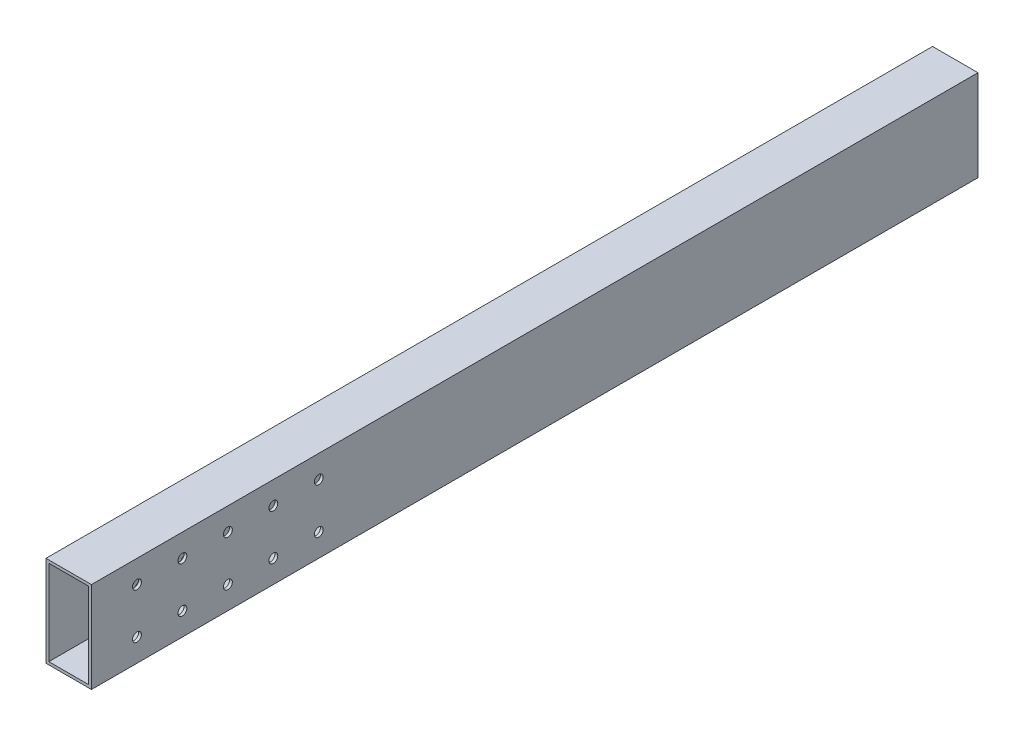
from build123d import *

# Parameters (mm, degrees)
SKETCH1_W           = 25.4
SKETCH1_H           = 50.8
SKETCH1_W_2         = 22.225
SKETCH1_H_2         = 47.625
BOSS_EXTRUDE1_DEPTH = 495.3
CUT_EXTRUDE1_REACH  = 500.546
SKETCH2_R           = 2.4892
CUT_EXTRUDE2_REACH  = 500.546
SKETCH3_R           = 14.2875
SKETCH3_R_2         = 2.4892
SKETCH2_3_R         = 2.4892
CUT_EXTRUDE5_DEPTH  = 499.54577523
CUT_EXTRUDE6_REACH  = 500.546
SKETCH4_R           = 2.4892


with BuildPart() as part:
    # Sketch1 → Boss-Extrude1 (new body)
    with BuildSketch(Plane.XY):
        with Locations((12.7, 25.4)):
            Rectangle(SKETCH1_W, SKETCH1_H)
        with Locations((12.7, 25.4)):
            Rectangle(SKETCH1_W_2, SKETCH1_H_2, mode=Mode.SUBTRACT)
    extrude(amount=BOSS_EXTRUDE1_DEPTH)

    # Sketch2 → Cut-Extrude1 (cut, up to next)
    with BuildSketch(Plane.ZY.offset(-25.4), mode=Mode.PRIVATE) as cut_extrude1_sk1:
        with Locations((393.7, 38.1)):
            Circle(SKETCH2_R)
    cut_extrude1_tool1 = extrude(cut_extrude1_sk1.sketch, amount=CUT_EXTRUDE1_REACH, mode=Mode.PRIVATE) & part.part
    # Sketch2 → Cut-Extrude1 (cut, up to next)
    with BuildSketch(Plane.ZY.offset(-25.4), mode=Mode.PRIVATE) as cut_extrude1_sk2:
        with Locations((368.3, 38.1)):
            Circle(SKETCH2_R)
    cut_extrude1_tool2 = extrude(cut_extrude1_sk2.sketch, amount=CUT_EXTRUDE1_REACH, mode=Mode.PRIVATE) & part.part
    # Sketch2 → Cut-Extrude1 (cut, up to next)
    with BuildSketch(Plane.ZY.offset(-25.4), mode=Mode.PRIVATE) as cut_extrude1_sk3:
        with Locations((393.7, 12.7)):
            Circle(SKETCH2_R)
    cut_extrude1_tool3 = extrude(cut_extrude1_sk3.sketch, amount=CUT_EXTRUDE1_REACH, mode=Mode.PRIVATE) & part.part
    # Sketch2 → Cut-Extrude1 (cut, up to next)
    with BuildSketch(Plane.ZY.offset(-25.4), mode=Mode.PRIVATE) as cut_extrude1_sk4:
        with Locations((368.3, 12.7)):
            Circle(SKETCH2_R)
    cut_extrude1_tool4 = extrude(cut_extrude1_sk4.sketch, amount=CUT_EXTRUDE1_REACH, mode=Mode.PRIVATE) & part.part
    add(cut_extrude1_tool1.solids().sort_by_distance((25.4, 38.1, 393.7))[0], mode=Mode.SUBTRACT)
    add(cut_extrude1_tool2.solids().sort_by_distance((25.4, 38.1, 368.3))[0], mode=Mode.SUBTRACT)
    add(cut_extrude1_tool3.solids().sort_by_distance((25.4, 12.7, 393.7))[0], mode=Mode.SUBTRACT)
    add(cut_extrude1_tool4.solids().sort_by_distance((25.4, 12.7, 368.3))[0], mode=Mode.SUBTRACT)

    # Sketch3 → Cut-Extrude2 (cut, up to next)
    with BuildSketch(Plane.ZY, mode=Mode.PRIVATE) as cut_extrude2_sk1:
        with Locations((114.3, 25.4)):
            Circle(SKETCH3_R)
    cut_extrude2_tool1 = extrude(cut_extrude2_sk1.sketch, amount=-CUT_EXTRUDE2_REACH, mode=Mode.PRIVATE) & part.part
    # Sketch3 → Cut-Extrude2 (cut, up to next)
    with BuildSketch(Plane.ZY, mode=Mode.PRIVATE) as cut_extrude2_sk2:
        with Locations((139.7, 41.275)):
            Circle(SKETCH3_R_2)
    cut_extrude2_tool2 = extrude(cut_extrude2_sk2.sketch, amount=-CUT_EXTRUDE2_REACH, mode=Mode.PRIVATE) & part.part
    # Sketch3 → Cut-Extrude2 (cut, up to next)
    with BuildSketch(Plane.ZY, mode=Mode.PRIVATE) as cut_extrude2_sk3:
        with Locations((88.9, 41.275)):
            Circle(SKETCH3_R_2)
    cut_extrude2_tool3 = extrude(cut_extrude2_sk3.sketch, amount=-CUT_EXTRUDE2_REACH, mode=Mode.PRIVATE) & part.part
    # Sketch3 → Cut-Extrude2 (cut, up to next)
    with BuildSketch(Plane.ZY, mode=Mode.PRIVATE) as cut_extrude2_sk4:
        with Locations((88.9, 9.525)):
            Circle(SKETCH3_R_2)
    cut_extrude2_tool4 = extrude(cut_extrude2_sk4.sketch, amount=-CUT_EXTRUDE2_REACH, mode=Mode.PRIVATE) & part.part
    # Sketch3 → Cut-Extrude2 (cut, up to next)
    with BuildSketch(Plane.ZY, mode=Mode.PRIVATE) as cut_extrude2_sk5:
        with Locations((139.7, 9.525)):
            Circle(SKETCH3_R_2)
    cut_extrude2_tool5 = extrude(cut_extrude2_sk5.sketch, amount=-CUT_EXTRUDE2_REACH, mode=Mode.PRIVATE) & part.part
    add(cut_extrude2_tool1.solids().sort_by_distance((0, 25.4, 114.3))[0], mode=Mode.SUBTRACT)
    add(cut_extrude2_tool2.solids().sort_by_distance((0, 41.275, 139.7))[0], mode=Mode.SUBTRACT)
    add(cut_extrude2_tool3.solids().sort_by_distance((0, 41.275, 88.9))[0], mode=Mode.SUBTRACT)
    add(cut_extrude2_tool4.solids().sort_by_distance((0, 9.525, 88.9))[0], mode=Mode.SUBTRACT)
    add(cut_extrude2_tool5.solids().sort_by_distance((0, 9.525, 139.7))[0], mode=Mode.SUBTRACT)

    # Sketch2<3> → Cut-Extrude5 (cut, through all)
    with BuildSketch(Plane.ZY.offset(-25.4)):
        with Locations((444.5, 38.1)):
            Circle(SKETCH2_3_R)
        with Locations((419.1, 38.1)):
            Circle(SKETCH2_3_R)
        with Locations((444.5, 12.7)):
            Circle(SKETCH2_3_R)
        with Locations((419.1, 12.7)):
            Circle(SKETCH2_3_R)
        with Locations((469.9, 12.7)):
            Circle(SKETCH2_3_R)
        with Locations((469.9, 38.1)):
            Circle(SKETCH2_3_R)
    extrude(amount=CUT_EXTRUDE5_DEPTH, mode=Mode.SUBTRACT)

    # Sketch4 → Cut-Extrude6 (cut, up to next)
    with BuildSketch(Plane.ZY, mode=Mode.PRIVATE) as cut_extrude6_sk1:
        with Locations((12.7, 38.1)):
            Circle(SKETCH4_R)
    cut_extrude6_tool1 = extrude(cut_extrude6_sk1.sketch, amount=-CUT_EXTRUDE6_REACH, mode=Mode.PRIVATE) & part.part
    # Sketch4 → Cut-Extrude6 (cut, up to next)
    with BuildSketch(Plane.ZY, mode=Mode.PRIVATE) as cut_extrude6_sk2:
        with Locations((25.4, 38.1)):
            Circle(SKETCH4_R)
    cut_extrude6_tool2 = extrude(cut_extrude6_sk2.sketch, amount=-CUT_EXTRUDE6_REACH, mode=Mode.PRIVATE) & part.part
    # Sketch4 → Cut-Extrude6 (cut, up to next)
    with BuildSketch(Plane.ZY, mode=Mode.PRIVATE) as cut_extrude6_sk3:
        with Locations((38.1, 38.1)):
            Circle(SKETCH4_R)
    cut_extrude6_tool3 = extrude(cut_extrude6_sk3.sketch, amount=-CUT_EXTRUDE6_REACH, mode=Mode.PRIVATE) & part.part
    # Sketch4 → Cut-Extrude6 (cut, up to next)
    with BuildSketch(Plane.ZY, mode=Mode.PRIVATE) as cut_extrude6_sk4:
        with Locations((25.4, 12.7)):
            Circle(SKETCH4_R)
    cut_extrude6_tool4 = extrude(cut_extrude6_sk4.sketch, amount=-CUT_EXTRUDE6_REACH, mode=Mode.PRIVATE) & part.part
    # Sketch4 → Cut-Extrude6 (cut, up to next)
    with BuildSketch(Plane.ZY, mode=Mode.PRIVATE) as cut_extrude6_sk5:
        with Locations((38.1, 12.7)):
            Circle(SKETCH4_R)
    cut_extrude6_tool5 = extrude(cut_extrude6_sk5.sketch, amount=-CUT_EXTRUDE6_REACH, mode=Mode.PRIVATE) & part.part
    # Sketch4 → Cut-Extrude6 (cut, up to next)
    with BuildSketch(Plane.ZY, mode=Mode.PRIVATE) as cut_extrude6_sk6:
        with Locations((12.7, 12.7)):
            Circle(SKETCH4_R)
    cut_extrude6_tool6 = extrude(cut_extrude6_sk6.sketch, amount=-CUT_EXTRUDE6_REACH, mode=Mode.PRIVATE) & part.part
    add(cut_extrude6_tool1.solids().sort_by_distance((0, 38.1, 12.7))[0], mode=Mode.SUBTRACT)
    add(cut_extrude6_tool2.solids().sort_by_distance((0, 38.1, 25.4))[0], mode=Mode.SUBTRACT)
    add(cut_extrude6_tool3.solids().sort_by_distance((0, 38.1, 38.1))[0], mode=Mode.SUBTRACT)
    add(cut_extrude6_tool4.solids().sort_by_distance((0, 12.7, 25.4))[0], mode=Mode.SUBTRACT)
    add(cut_extrude6_tool5.solids().sort_by_distance((0, 12.7, 38.1))[0], mode=Mode.SUBTRACT)
    add(cut_extrude6_tool6.solids().sort_by_distance((0, 12.7, 12.7))[0], mode=Mode.SUBTRACT)


solid = part.part
